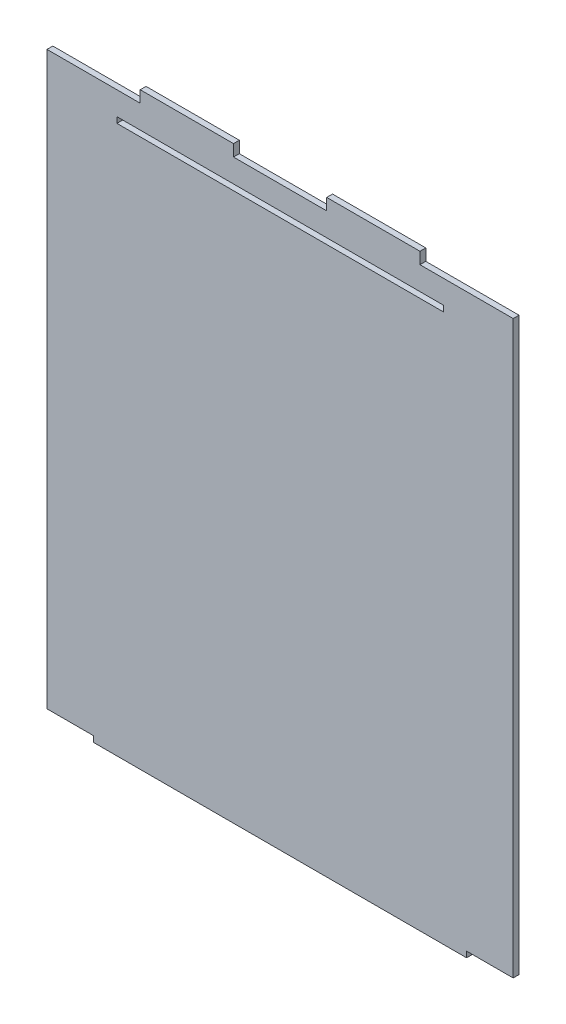
from build123d import *

# Parameters (mm, degrees)
SKETCH1_W           = 177.8
SKETCH1_H           = 3.175
BOSS_EXTRUDE1_DEPTH = 3.175


with BuildPart() as part:
    # Sketch1 → Boss-Extrude1 (new body)
    with BuildSketch(Plane.XY):
        Polygon((0, 301.625), (0, -9.525), (25.4, -9.525), (25.4, -12.7), (228.6, -12.7), (228.6, -9.525), (254, -9.525), (254, 301.625), (203.2, 301.625), (203.2, 307.975), (152.4, 307.975), (152.4, 301.625), (101.6, 301.625), (101.6, 307.975), (50.8, 307.975), (50.8, 301.625), align=None)
        with Locations((127, 287.3375)):
            Rectangle(SKETCH1_W, SKETCH1_H, mode=Mode.SUBTRACT)
    extrude(amount=BOSS_EXTRUDE1_DEPTH)


solid = part.part
